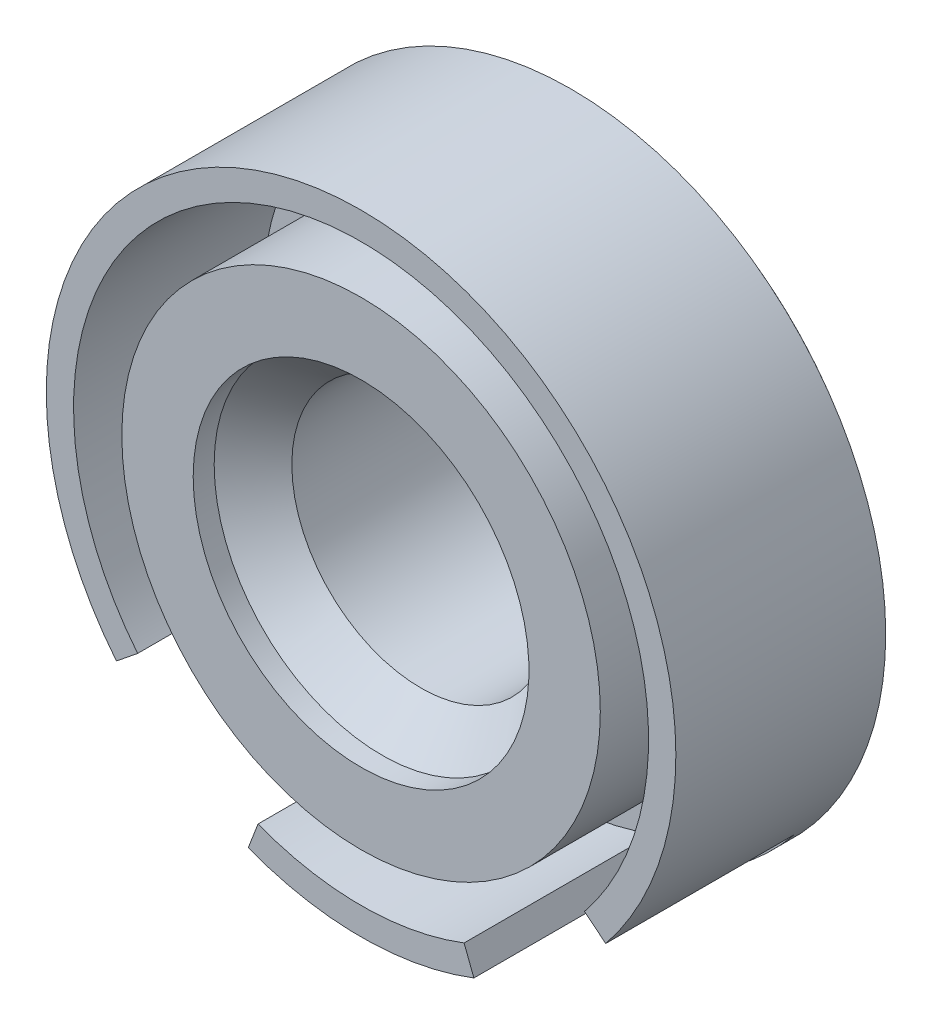
from build123d import *

# Parameters (mm, degrees)
CUT_EXTRUDE4_DEPTH = 2.5
CUT_REVOLVE1_START = 4
CUT_REVOLVE1_DEPTH = 9
CIRPATTERN1_COUNT  = 5


# Read off the part's stored shape, not the designer's step: Cut-Revolve1
with BuildPart() as part:
    # Sketch1 → Revolve1 (revolve)
    with BuildSketch(Plane(origin=(0, 0, 0), x_dir=(1, 0, 0), z_dir=(0, 1, 0)), mode=Mode.PRIVATE) as revolve1_sk:
        with BuildLine():
            Line((6.15, -10.15), (6.15, 0))
            ThreePointArc((6.15, 0), (10.822325438, -0.770389957), (15, -3))
            Line((15, -3), (15, -13))
            Line((15, -13), (13.7, -13))
            Line((13.7, -13), (13.7, -4))
            Line((13.7, -4), (11.4, -4))
            Line((11.4, -4), (11.4, -13))
            Line((11.4, -13), (8, -13))
            Line((8, -13), (8, -12))
            Line((8, -12), (6.15, -10.15))
        make_face()
    revolve(revolve1_sk.sketch.rotate(Axis((0, 0, 0), (0, 0, 1)), 180), axis=Axis((0, 0, 0), (0, 0, 1)))

    # Sketch7 → Cut-Extrude4 (cut)
    with BuildSketch(Plane.XY):
        Polygon((0, -8.198373822), (7.1, -4.099186911), (7.1, 4.099186911), (0, 8.198373822), (-7.1, 4.099186911), (-7.1, -4.099186911), align=None)
    extrude(amount=CUT_EXTRUDE4_DEPTH, mode=Mode.SUBTRACT)

    # Cut-Revolve1 outline → Cut-Revolve1 (cut)
    with BuildSketch(Plane.XY.offset(CUT_REVOLVE1_START)):
        with BuildLine():
            Line((11.657189422, -9.439805866), (10.646899672, -8.621689357))
            ThreePointArc((10.646899672, -8.621689357), (8.052657957, -11.083532823), (4.909640909, -12.790051843))
            Line((4.909640909, -12.790051843), (5.375519243, -14.003706397))
            ThreePointArc((5.375519243, -14.003706397), (8.816778784, -12.135254916), (11.657189422, -9.439805866))
        make_face()
    cut_revolve1 = extrude(amount=CUT_REVOLVE1_DEPTH, mode=Mode.SUBTRACT)

    # CirPattern1: Cut-Revolve1 ×5 about axis, 3 skipped
    cirpattern1_axis = Axis((0, 0, -1.227748989), (0, 0, 1))
    add([cut_revolve1.rotate(cirpattern1_axis, i * 360 / CIRPATTERN1_COUNT) for i in range(1, CIRPATTERN1_COUNT) if i not in (1, 2, 3)], mode=Mode.SUBTRACT)


solid = part.part
